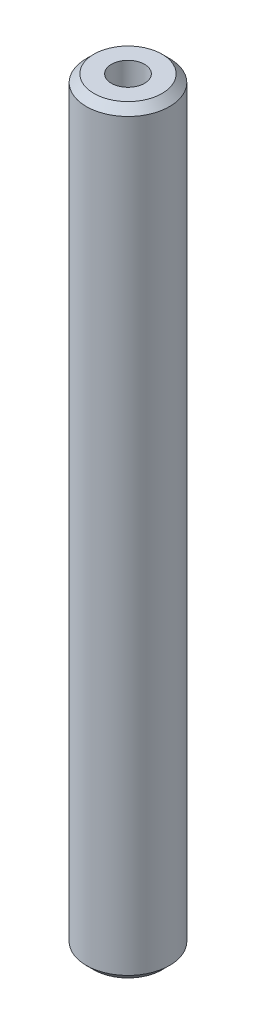
from build123d import *

# Parameters (mm, degrees)
SKETCH1_R           = 15
BOSS_EXTRUDE1_DEPTH = 273.531049681
SKETCH2_R           = 5.962834188
CUT_EXTRUDE1_DEPTH  = 275.352392262
CHAMFER1_SIZE       = 2.724216726


with BuildPart() as part:
    # Sketch1 → Boss-Extrude1 (new body)
    with BuildSketch(Plane(origin=(0, 0, 0), x_dir=(1, 0, 0), z_dir=(0, 1, 0))):
        Circle(SKETCH1_R)
    extrude(amount=BOSS_EXTRUDE1_DEPTH)

    # Sketch2 → Cut-Extrude1 (cut, through all)
    with BuildSketch(Plane(origin=(0, 0, 0), x_dir=(1, 0, 0), z_dir=(0, 1, 0))):
        Circle(SKETCH2_R)
    extrude(amount=CUT_EXTRUDE1_DEPTH, mode=Mode.SUBTRACT)

    # Chamfer1
    chamfer1_edges = [part.edges().sort_by_distance(p)[0] for p in [
        (-15, 273.531049681, 0),
        (-15, 0, 0),
    ]]
    chamfer(chamfer1_edges, length=CHAMFER1_SIZE)


solid = part.part
